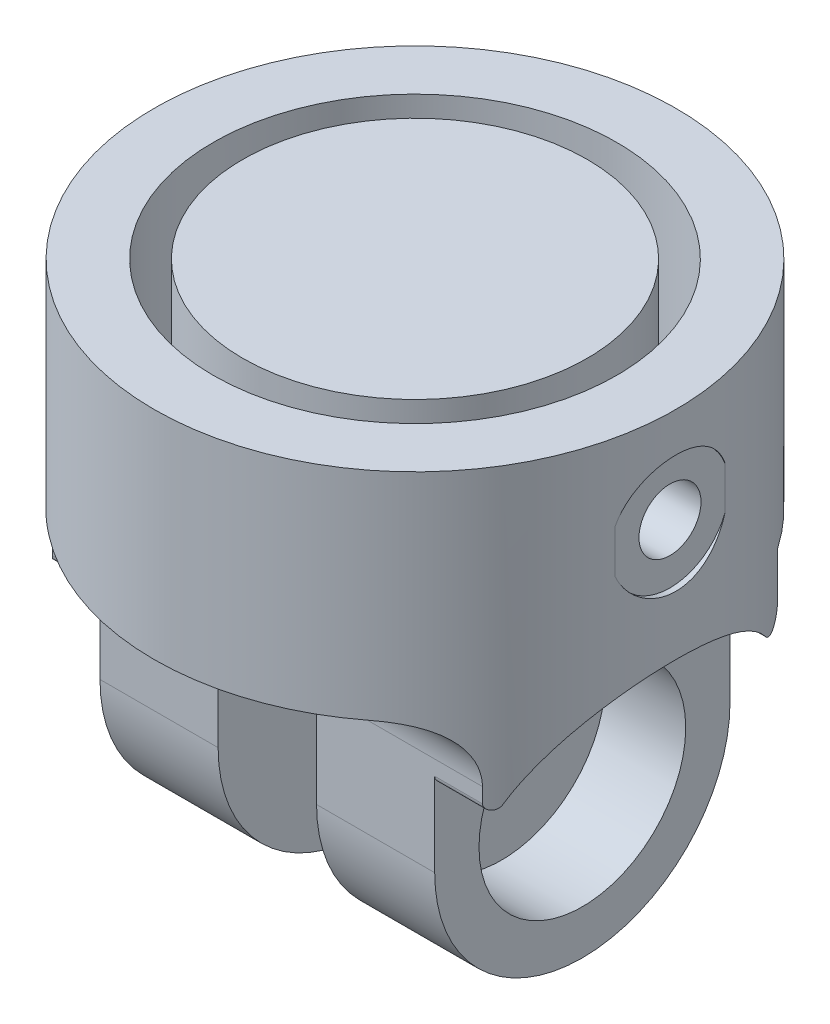
from build123d import *
from build123d.topology import SkipClean

# Parameters (mm, degrees)
SKETCH1_R                = 13.25
SKETCH1_R_2              = 10.25
BOSS_EXTRUDE1_DEPTH      = 10
SKETCH1_R_3              = 8.75
BOSS_EXTRUDE1_2_DEPTH    = 10
BOSS_EXTRUDE2_START      = 1
SKETCH3_R                = 13.25
BOSS_EXTRUDE2_DEPTH      = 1
SKETCH4_W                = 6
SKETCH4_H                = 15
BOSS_EXTRUDE3_DEPTH      = 16
CUT_EXTRUDE1_DEPTH       = 31.620662958
CUT_EXTRUDE1_DEPTH_BACK  = 31.620662958
SKETCH5_R                = 1.75
SKETCH6_R                = 5.25
CUT_EXTRUDE2_DEPTH       = 4.1
CUT_EXTRUDE5_DEPTH       = 5.5
CUT_EXTRUDE5_DEPTH_BACK  = 28.648191623
SKETCH8_R                = 0.825
SKETCH9_R                = 0.825
CUT_EXTRUDE3_DEPTH       = 5.5
CUT_EXTRUDE6_DEPTH       = 5.5
CUT_EXTRUDE6_DEPTH_BACK  = 26.613717089
SKETCH10_R               = 0.825
CUT_EXTRUDE7_DEPTH       = 5.5
CUT_EXTRUDE7_DEPTH_BACK  = 27.58951867
SKETCH11_R               = 0.825
CUT_EXTRUDE8_DEPTH       = 5.5
CUT_EXTRUDE8_DEPTH_BACK  = 28.648191679
SKETCH12_R               = 0.825
CUT_EXTRUDE9_DEPTH       = 5.5
CUT_EXTRUDE9_DEPTH_BACK  = 29.780592473
SKETCH14_R               = 0.825
SKETCH20_R               = 3
CUT_EXTRUDE10_DEPTH      = 0.3
BOSS_EXTRUDE4_REACH      = 32.346
BOSS_EXTRUDE4_END_RADIUS = 13.25
FILLET1_R                = 3


with BuildPart() as part:
    # Sketch1 → Boss-Extrude1 (new body)
    with BuildSketch(Plane(origin=(0, 0, 0), x_dir=(1, 0, 0), z_dir=(0, 1, 0))):
        with Locations(Location((0, 0, 0), (0, 0, 270))):
            Circle(SKETCH1_R)
        with Locations(Location((0, 0, 0), (0, 0, 270))):
            Circle(SKETCH1_R_2, mode=Mode.SUBTRACT)
    extrude(amount=BOSS_EXTRUDE1_DEPTH)



with BuildPart() as body_2:
    # Sketch1 → Boss-Extrude1 2 (new body)
    with BuildSketch(Plane(origin=(0, 0, 0), x_dir=(1, 0, 0), z_dir=(0, 1, 0))):
        with Locations(Location((0, 0, 0), (0, 0, 270))):
            Circle(SKETCH1_R_3)
    extrude(amount=BOSS_EXTRUDE1_2_DEPTH)


with BuildPart() as part_1:
    add(part.part)

    add(body_2.part)  # Boss-Extrude2 merges body 2
    # Sketch3 → Boss-Extrude2 (add)
    with BuildSketch(Plane.XZ.offset(BOSS_EXTRUDE2_START)):
        with Locations(Location((0, 0, 0), (0, 0, 270))):
            Circle(SKETCH3_R)
    extrude(amount=-BOSS_EXTRUDE2_DEPTH)

    # Sketch4 → Boss-Extrude3 (add)
    with BuildSketch(Plane.XZ.offset(1)):
        with Locations((5.5, 0)):
            Rectangle(SKETCH4_W, SKETCH4_H)
        with Locations((-5.5, 0)):
            Rectangle(SKETCH4_W, SKETCH4_H)
    extrude(amount=BOSS_EXTRUDE3_DEPTH)

    # Sketch5 → Cut-Extrude1 (cut, two sides: drawn at the far end of the back side and taken through both)
    with BuildSketch(Plane(origin=(8.5, 0, 0), x_dir=(0, 0, -1), z_dir=(1, 0, 0)).offset(-CUT_EXTRUDE1_DEPTH_BACK)):
        with Locations((0, -9)):
            Circle(SKETCH5_R)
        with BuildLine():
            Line((7.5, -9), (7.5, -17.161887877))
            Line((7.5, -17.161887877), (-7.5, -17.161887877))
            Line((-7.5, -17.161887877), (-7.5, -9))
            ThreePointArc((-7.5, -9), (0, -16.5), (7.5, -9))
        make_face()
    extrude(amount=CUT_EXTRUDE1_DEPTH + CUT_EXTRUDE1_DEPTH_BACK, mode=Mode.SUBTRACT)

    # Sketch6 → Cut-Extrude2 (cut)
    with BuildSketch(Plane(origin=(8.5, 0, 0), x_dir=(0, 0, -1), z_dir=(1, 0, 0))):
        with Locations((0, -9)):
            Circle(SKETCH6_R)
    cut_extrude2 = extrude(amount=-CUT_EXTRUDE2_DEPTH, mode=Mode.SUBTRACT)

    # Mirror1: Cut-Extrude2 across plane
    add(cut_extrude2.mirror(Plane(origin=(0, 0, 0), x_dir=(0, 0, 1), z_dir=(1, 0, 0))), mode=Mode.SUBTRACT)

    # Sketch8 → Cut-Extrude5 (cut, two sides: drawn at the far end of the back side and taken through both)
    with BuildSketch(Plane(origin=(2.25, -1, -3.6), x_dir=(1, 0, 0), z_dir=(0, 1, 0)).offset(-CUT_EXTRUDE5_DEPTH_BACK)):
        with Locations(Location((0, 0, 0), (0, 0, 270))):
            Circle(SKETCH8_R)
    extrude(amount=CUT_EXTRUDE5_DEPTH + CUT_EXTRUDE5_DEPTH_BACK, mode=Mode.SUBTRACT)

    # Sketch9 → Cut-Extrude3 (cut)
    with BuildSketch(Plane(origin=(2.25, -1, -1.8), x_dir=(1, 0, 0), z_dir=(0, 0.9729323239211833, 0.2310902271177338))):
        with Locations(Location((0, 0, 0), (0, 0, 180))):
            Circle(SKETCH9_R)
    extrude(amount=CUT_EXTRUDE3_DEPTH, mode=Mode.SUBTRACT)

    # Sketch10 → Cut-Extrude6 (cut, two sides: drawn at the far end of the back side and taken through both)
    with BuildSketch(Plane(origin=(2.25, -1, 0), x_dir=(1, 0, 0), z_dir=(0, 0.8930285549745877, 0.45)).offset(-CUT_EXTRUDE6_DEPTH_BACK)):
        with Locations(Location((0, 0, 0), (0, 0, 270))):
            Circle(SKETCH10_R)
    extrude(amount=CUT_EXTRUDE6_DEPTH + CUT_EXTRUDE6_DEPTH_BACK, mode=Mode.SUBTRACT)

    # Sketch11 → Cut-Extrude7 (cut, two sides: drawn at the far end of the back side and taken through both)
    with BuildSketch(Plane(origin=(2.25, -1, 1.8), x_dir=(1, 0, 0), z_dir=(0, 0.7801899086921528, 0.6255427294557346)).offset(-CUT_EXTRUDE7_DEPTH_BACK)):
        with Locations(Location((0, 0, 0), (0, 0, 270))):
            Circle(SKETCH11_R)
    extrude(amount=CUT_EXTRUDE7_DEPTH + CUT_EXTRUDE7_DEPTH_BACK, mode=Mode.SUBTRACT)

    # Sketch12 → Cut-Extrude8 (cut, two sides: drawn at the far end of the back side and taken through both)
    with BuildSketch(Plane(origin=(2.25, -1, 3.6), x_dir=(1, 0, 0), z_dir=(0, 0.6632016632016627, 0.7484407484407488)).offset(-CUT_EXTRUDE8_DEPTH_BACK)):
        with Locations(Location((0, 0, 0), (0, 0, 270))):
            Circle(SKETCH12_R)
    extrude(amount=CUT_EXTRUDE8_DEPTH + CUT_EXTRUDE8_DEPTH_BACK, mode=Mode.SUBTRACT)

    # Sketch14 → Cut-Extrude9 (cut, two sides: drawn at the far end of the back side and taken through both)
    with BuildSketch(Plane(origin=(2.25, -1, 5.4), x_dir=(1, 0, 0), z_dir=(0, 0.5603645573976164, 0.8282460762433914)).offset(-CUT_EXTRUDE9_DEPTH_BACK)):
        with Locations(Location((0, 0, 0), (0, 0, 270))):
            Circle(SKETCH14_R)
    extrude(amount=CUT_EXTRUDE9_DEPTH + CUT_EXTRUDE9_DEPTH_BACK, mode=Mode.SUBTRACT)

    # Sketch18 → Tap Drill for M3 Helicoil1 (revolve, cut)
    with BuildSketch(Plane(origin=(13.25, 5, 0), x_dir=(0, 0, -1), z_dir=(0, 1, 0))):
        Polygon((0, 0), (0, 6.946355475), (1.575, 6), (1.575, 0), align=None)
    tap_drill_for_m3_helicoil1 = revolve(axis=Axis((19.6, 5, 0), (-1, 0, 0)), mode=Mode.SUBTRACT)

    # Sketch20 → Cut-Extrude10 (cut)
    with BuildSketch(Plane(origin=(13.25, 0, 0), x_dir=(0, 0, -1), z_dir=(1, 0, 0))):
        with Locations((0, 5)):
            Circle(SKETCH20_R)
    cut_extrude10 = extrude(amount=-CUT_EXTRUDE10_DEPTH, mode=Mode.SUBTRACT)

    # Boss-Extrude4: up to this cylinder (the profile starts inside it)
    with SkipClean():  # the faces are left unmerged after this step: merging them gives an invalid solid
        boss_extrude4_end = Plane(origin=(0, -1.656593, 0), z_dir=(0, -1, 0)) * Cylinder(BOSS_EXTRUDE4_END_RADIUS, 92.192, mode=Mode.PRIVATE)
        # Sketch21 → Boss-Extrude4 (add, up to the surface)
        with BuildSketch(Plane(origin=(8.5, 0, 0), x_dir=(0, 0, -1), z_dir=(1, 0, 0)), mode=Mode.PRIVATE) as boss_extrude4_sk1:
            with BuildLine():
                Line((7.5, -0.12519572), (7.5, -3.18799105))
                ThreePointArc((7.5, -3.18799105), (6.955142722, -3.974197034), (6.02768946, -3.740060858))
                ThreePointArc((6.02768946, -3.740060858), (-0.731589446, -1.033521676), (-6.884869887, -4.925866149))
                ThreePointArc((-6.884869887, -4.925866149), (-7.256673081, -5.076376976), (-7.5, -4.757499046))
                Line((-7.5, -4.757499046), (-7.5, -0.12519572))
                Line((-7.5, -0.12519572), (7.5, -0.12519572))
            make_face()
        boss_extrude4_tool1 = extrude(boss_extrude4_sk1.sketch, amount=BOSS_EXTRUDE4_REACH, mode=Mode.PRIVATE) & boss_extrude4_end
        boss_extrude4 = boss_extrude4_tool1.solids().sort_by_distance((8.5, -1.656593, -7.342003))[0]
        add(boss_extrude4)

    # Mirror2: Tap Drill for M3 Helicoil1, Cut-Extrude10, Boss-Extrude4 across plane
    with SkipClean():  # the faces are left unmerged after this step: merging them gives an invalid solid
        add(tap_drill_for_m3_helicoil1.mirror(Plane(origin=(0, 0, 0), x_dir=(0, 0, 1), z_dir=(1, 0, 0))), mode=Mode.SUBTRACT)
        add(cut_extrude10.mirror(Plane(origin=(0, 0, 0), x_dir=(0, 0, 1), z_dir=(1, 0, 0))), mode=Mode.SUBTRACT)
        add(boss_extrude4.mirror(Plane(origin=(0, 0, 0), x_dir=(0, 0, 1), z_dir=(1, 0, 0))))
    add(part_1.part.scale(1), mode=Mode.REPLACE)  # the faces are merged on a copy

    # Fillet1
    # the kernel refuses this fillet: 3 mm, written as the material it adds along each edge
    with BuildSketch(Plane(origin=(-5, -1, 7.5), x_dir=(0, 0, 1), z_dir=(1, 0, 0))) as fillet1_piece_1_section:
        with BuildLine():
            CenterArc((FILLET1_R, FILLET1_R), FILLET1_R, 180, 90)
            Line((0, FILLET1_R), (0, 0))
            Line((0, 0), (FILLET1_R, 0))
        make_face()
    fillet1_piece_1 = extrude(amount=13.5, mode=Mode.PRIVATE)
    fillet1_piece_1 = split(fillet1_piece_1, bisect_by=Plane(origin=(-2.5, -1.679185343, 8.179185343), z_dir=(-1, 0, 0)), keep=Keep.TOP, mode=Mode.PRIVATE)
    add(fillet1_piece_1)
    with BuildSketch(Plane(origin=(2.5, -1, 7.5), x_dir=(0, 0, 1), z_dir=(1, 0, 0))) as fillet1_piece_2_section:
        with BuildLine():
            CenterArc((FILLET1_R, FILLET1_R), FILLET1_R, 180, 90)
            Line((0, FILLET1_R), (0, 0))
            Line((0, 0), (FILLET1_R, 0))
        make_face()
    fillet1_piece_2 = extrude(amount=6, mode=Mode.PRIVATE)
    fillet1_piece_2 = fillet1_piece_2 & Plane(origin=(0, -1.679409968, 0), x_dir=(0, 0, -1), z_dir=(0, -1, 0)) * Cylinder(13.25, 24, mode=Mode.PRIVATE)
    add(fillet1_piece_2)
    with BuildSketch(Plane(origin=(5, -1, 7.5), x_dir=(0, 0, 1), z_dir=(-1, 0, 0))) as fillet1_piece_3_section:
        with BuildLine():
            CenterArc((FILLET1_R, -FILLET1_R), FILLET1_R, 90, 90)
            Line((0, -FILLET1_R), (0, 0))
            Line((0, 0), (FILLET1_R, 0))
        make_face()
    fillet1_piece_3 = extrude(amount=13.5, mode=Mode.PRIVATE)
    fillet1_piece_3 = split(fillet1_piece_3, bisect_by=Plane(origin=(2.5, -1.679185343, 8.179185343), z_dir=(1, 0, 0)), keep=Keep.TOP, mode=Mode.PRIVATE)
    add(fillet1_piece_3)
    with BuildSketch(Plane(origin=(-2.5, -1, 7.5), x_dir=(0, 0, 1), z_dir=(-1, 0, 0))) as fillet1_piece_4_section:
        with BuildLine():
            CenterArc((FILLET1_R, -FILLET1_R), FILLET1_R, 90, 90)
            Line((0, -FILLET1_R), (0, 0))
            Line((0, 0), (FILLET1_R, 0))
        make_face()
    fillet1_piece_4 = extrude(amount=6, mode=Mode.PRIVATE)
    fillet1_piece_4 = fillet1_piece_4 & Plane(origin=(0, -1.679409968, 0), x_dir=(0, 0, -1), z_dir=(0, -1, 0)) * Cylinder(13.25, 24, mode=Mode.PRIVATE)
    add(fillet1_piece_4)
    with BuildSketch(Plane(origin=(-18.423026137, -1, 7.5), x_dir=(0, 0, 1), z_dir=(1, 0, 0))) as fillet1_piece_5_section:
        with BuildLine():
            CenterArc((FILLET1_R, FILLET1_R), FILLET1_R, 180, 90)
            Line((0, FILLET1_R), (0, 0))
            Line((0, 0), (FILLET1_R, 0))
        make_face()
    fillet1_piece_5 = extrude(amount=9.923026137, mode=Mode.PRIVATE)
    fillet1_piece_5 = fillet1_piece_5 & Plane(origin=(0, -1.786217217, 0), x_dir=(0, 0, -1), z_dir=(0, -1, 0)) * Cylinder(13.25, 32, mode=Mode.PRIVATE)
    add(fillet1_piece_5)
    with BuildSketch(Plane(origin=(18.423026137, -1, 7.5), x_dir=(0, 0, 1), z_dir=(-1, 0, 0))) as fillet1_piece_6_section:
        with BuildLine():
            CenterArc((FILLET1_R, -FILLET1_R), FILLET1_R, 90, 90)
            Line((0, -FILLET1_R), (0, 0))
            Line((0, 0), (FILLET1_R, 0))
        make_face()
    fillet1_piece_6 = extrude(amount=9.923026137, mode=Mode.PRIVATE)
    fillet1_piece_6 = fillet1_piece_6 & Plane(origin=(0, -1.786216754, 0), x_dir=(0, 0, -1), z_dir=(0, -1, 0)) * Cylinder(13.25, 32, mode=Mode.PRIVATE)
    add(fillet1_piece_6)


solid = part_1.part
